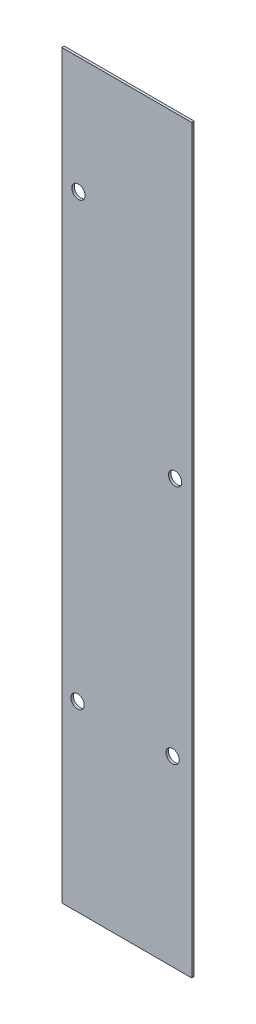
from build123d import *

# Parameters (mm, degrees)
SKETCH1_W          = 39
SKETCH1_H          = 222.25
BASE_FLANGE1_DEPTH = 0.7366
SKETCH2_R          = 1.984375
CUT_EXTRUDE1_DEPTH = 10


# Sheet-metal steps are written as plain solids
with BuildPart() as part:
    # Sketch1 → Base-Flange1 (new body)
    with BuildSketch(Plane.XY):
        with Locations((19.5, 111.125)):
            Rectangle(SKETCH1_W, SKETCH1_H)
    extrude(amount=-BASE_FLANGE1_DEPTH)

    # Sketch2 → Cut-Extrude1 (cut)
    with BuildSketch(Plane.XY):
        with Locations((5, 187.25)):
            Circle(SKETCH2_R)
        with Locations((34, 127.25)):
            Circle(SKETCH2_R)
        with Locations((4.7366, 54.75)):
            Circle(SKETCH2_R)
        with Locations((33.2634, 54.75)):
            Circle(SKETCH2_R)
    extrude(amount=-CUT_EXTRUDE1_DEPTH, mode=Mode.SUBTRACT)


solid = part.part
